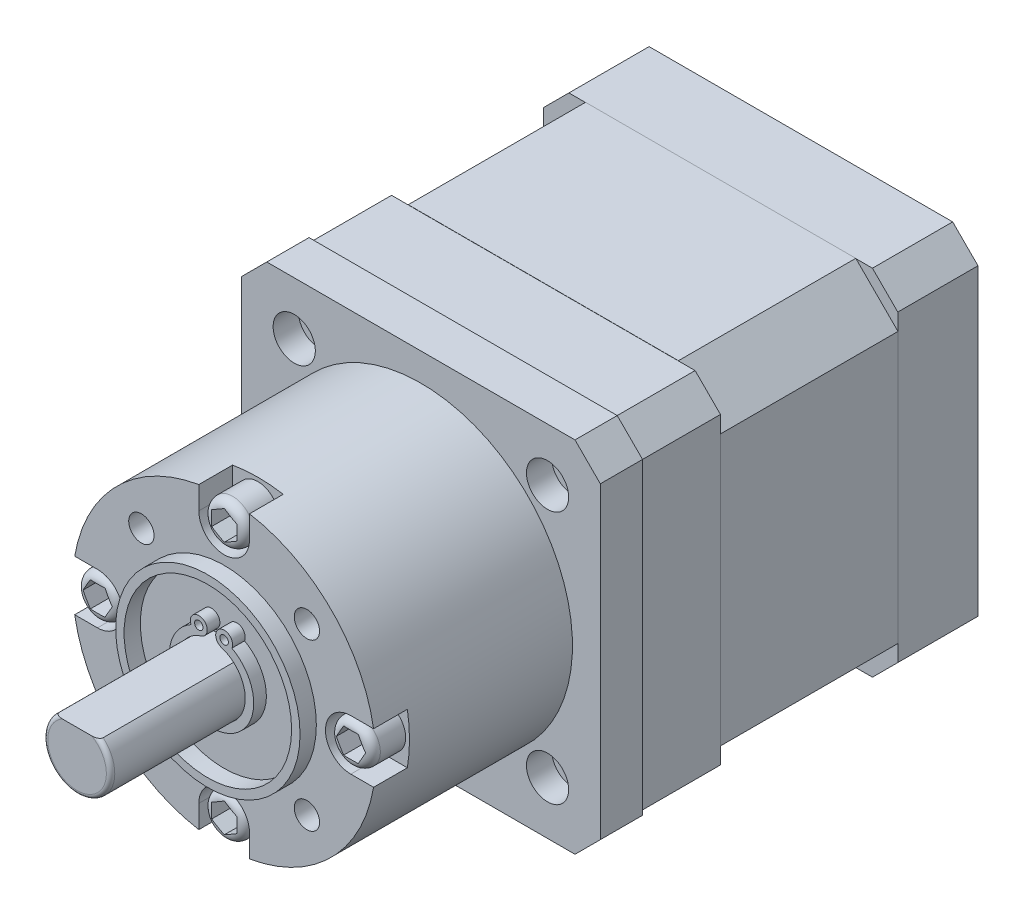
from build123d import *

# Parameters (mm, degrees)
SKETCH1_W              = 42
SKETCH1_H              = 42
BOSS_EXTRUDE1_DEPTH    = 21
CHAMFER1_SIZE          = 5
SKETCH2_W              = 41.95
SKETCH2_H              = 41.95
BOSS_EXTRUDE2_DEPTH    = 9.5
SKETCH3_R              = 17.95
BOSS_EXTRUDE3_DEPTH    = 24.3
SKETCH4_R              = 2
CUT_EXTRUDE1_DEPTH     = 1
SKETCH5_W              = 0.5
SKETCH5_H              = 1.25
SKETCH5_W_2            = 1.25
SKETCH5_H_2            = 0.5
CUT_EXTRUDE2_DEPTH     = 2
BOSS_EXTRUDE4_DEPTH    = 4
SKETCH11_R             = 3.97
BOSS_EXTRUDE5_DEPTH    = 17.42
CUT_EXTRUDE3_START     = -18
CUT_EXTRUDE3_DEPTH     = 18
SKETCH13_W             = 42.5
SKETCH13_H             = 42.5
BOSS_EXTRUDE6_DEPTH    = 5
SKETCH19_R             = 2.5
BOSS_EXTRUDE7_DEPTH    = 4
FILLET4_R              = 1
SKETCH20_R             = 0.5
BOSS_EXTRUDE8_DEPTH    = 1.5
SKETCH21_W             = 9
SKETCH21_H             = 3
SKETCH21_W_2           = 6
SKETCH21_H_2           = 2
BOSS_EXTRUDE9_DEPTH    = 1
SKETCH22_R             = 0.5
BOSS_EXTRUDE10_DEPTH   = 5
SKETCH23_R             = 0.5
BOSS_EXTRUDE11_DEPTH   = 5
BOSS_EXTRUDE11_2_DEPTH = 5
BOSS_EXTRUDE11_3_DEPTH = 5
BOSS_EXTRUDE11_4_DEPTH = 5
CHAMFER4_SIZE          = 3
SKETCH24_R             = 2.5
CUT_EXTRUDE4_DEPTH     = 3
SKETCH25_R             = 10.92
SKETCH25_R_2           = 9.92
BOSS_EXTRUDE12_DEPTH   = 1.93
SKETCH26_R             = 1.5
CUT_EXTRUDE5_DEPTH     = 7.3
FILLET5_R              = 0.5


with BuildPart() as part:
    # Sketch1 → Boss-Extrude1 (new body)
    with BuildSketch(Plane.XY):
        Rectangle(SKETCH1_W, SKETCH1_H)
    extrude(amount=BOSS_EXTRUDE1_DEPTH)

    # Chamfer1
    chamfer1_edges = [part.edges().sort_by_distance(p)[0] for p in [
        (21, -21, 10.5),
        (-21, -21, 10.5),
        (-21, 21, 10.5),
        (21, 21, 10.5),
    ]]
    chamfer(chamfer1_edges, length=CHAMFER1_SIZE)

    # Sketch2 → Boss-Extrude2 (add)
    with BuildSketch(Plane.XY.offset(21)):
        Rectangle(SKETCH2_W, SKETCH2_H)
    boss_extrude2 = extrude(amount=BOSS_EXTRUDE2_DEPTH)

    # Mirror1: Boss-Extrude2 across plane
    add(boss_extrude2.mirror(Plane.XY.offset(10.5)))

    # Sketch3 → Boss-Extrude3 (add)
    with BuildSketch(Plane.XY.offset(30.5)):
        Circle(SKETCH3_R)
    extrude(amount=BOSS_EXTRUDE3_DEPTH)

    # Sketch4 → Cut-Extrude1 (cut)
    with BuildSketch(Plane(origin=(0, 0, -9.5), x_dir=(-1, 0, 0), z_dir=(0, 0, -1))):
        with Locations((16, 16)):
            Circle(SKETCH4_R)
        with Locations((16, -16)):
            Circle(SKETCH4_R)
        with Locations((-16, -16)):
            Circle(SKETCH4_R)
        with Locations((-16, 16)):
            Circle(SKETCH4_R)
    extrude(amount=-CUT_EXTRUDE1_DEPTH, mode=Mode.SUBTRACT)

    # Sketch5 → Cut-Extrude2 (cut)
    with BuildSketch(Plane(origin=(0, 0, -8.5), x_dir=(-1, 0, 0), z_dir=(0, 0, -1))):
        with Locations((16, 16.875)):
            Rectangle(SKETCH5_W, SKETCH5_H)
        with Locations((15.125, 16)):
            Rectangle(SKETCH5_W_2, SKETCH5_H_2)
        with Locations((16, 16)):
            Rectangle(SKETCH5_W, SKETCH5_H_2)
        with Locations((16, 15.125)):
            Rectangle(SKETCH5_W, SKETCH5_H)
        with Locations((16.875, 16)):
            Rectangle(SKETCH5_W_2, SKETCH5_H_2)
        with Locations((-16, 16.875)):
            Rectangle(SKETCH5_W, SKETCH5_H)
        with Locations((-16, 16)):
            Rectangle(SKETCH5_W, SKETCH5_H_2)
        with Locations((-16.875, 16)):
            Rectangle(SKETCH5_W_2, SKETCH5_H_2)
        with Locations((-15.125, 16)):
            Rectangle(SKETCH5_W_2, SKETCH5_H_2)
        with Locations((-16, 15.125)):
            Rectangle(SKETCH5_W, SKETCH5_H)
        with Locations((-16, -15.125)):
            Rectangle(SKETCH5_W, SKETCH5_H)
        with Locations((-16, -16)):
            Rectangle(SKETCH5_W, SKETCH5_H_2)
        with Locations((-16, -16.875)):
            Rectangle(SKETCH5_W, SKETCH5_H)
        with Locations((-16.875, -16)):
            Rectangle(SKETCH5_W_2, SKETCH5_H_2)
        with Locations((-15.125, -16)):
            Rectangle(SKETCH5_W_2, SKETCH5_H_2)
        with Locations((16, -15.125)):
            Rectangle(SKETCH5_W, SKETCH5_H)
        with Locations((16, -16)):
            Rectangle(SKETCH5_W, SKETCH5_H_2)
        with Locations((16, -16.875)):
            Rectangle(SKETCH5_W, SKETCH5_H)
        with Locations((16.875, -16)):
            Rectangle(SKETCH5_W_2, SKETCH5_H_2)
        with Locations((15.125, -16)):
            Rectangle(SKETCH5_W_2, SKETCH5_H_2)
    extrude(amount=-CUT_EXTRUDE2_DEPTH, mode=Mode.SUBTRACT)

    # Sketch10 → Boss-Extrude4 (add)
    with BuildSketch(Plane.XY.offset(54.8)):
        with BuildLine():
            ThreePointArc((3, 15), (0, 12), (-3, 15))
            Line((-3, 15), (-3, 17.697528076))
            ThreePointArc((-3, 17.697528076), (-12.692566722, 12.692566722), (-17.697528076, 3))
            Line((-17.697528076, 3), (-15, 3))
            ThreePointArc((-15, 3), (-12, 0), (-15, -3))
            Line((-15, -3), (-17.697528076, -3))
            ThreePointArc((-17.697528076, -3), (-12.692566722, -12.692566722), (-3, -17.697528076))
            Line((-3, -17.697528076), (-3, -15))
            ThreePointArc((-3, -15), (0, -12), (3, -15))
            Line((3, -15), (3, -17.697528076))
            ThreePointArc((3, -17.697528076), (12.692566722, -12.692566722), (17.697528076, -3))
            Line((17.697528076, -3), (15, -3))
            ThreePointArc((15, -3), (12, 0), (15, 3))
            Line((15, 3), (17.697528076, 3))
            ThreePointArc((17.697528076, 3), (12.692566722, 12.692566722), (3, 17.697528076))
            Line((3, 17.697528076), (3, 15))
        make_face()
    extrude(amount=BOSS_EXTRUDE4_DEPTH)

    # Sketch11 → Boss-Extrude5 (add)
    with BuildSketch(Plane.XY.offset(58.8)):
        Circle(SKETCH11_R)
    extrude(amount=BOSS_EXTRUDE5_DEPTH)

    # Sketch12 → Cut-Extrude3 (cut)
    with BuildSketch(Plane.XY.offset(76.22).offset(CUT_EXTRUDE3_START)):
        with BuildLine():
            Line((-2.600173071, 3), (2.600173071, 3))
            ThreePointArc((2.600173071, 3), (0, 3.97), (-2.600173071, 3))
        make_face()
    extrude(amount=CUT_EXTRUDE3_DEPTH, mode=Mode.SUBTRACT)

    # Sketch13 → Boss-Extrude6 (add)
    with BuildSketch(Plane.XY.offset(30.5)):
        Rectangle(SKETCH13_W, SKETCH13_H)
    extrude(amount=BOSS_EXTRUDE6_DEPTH)

    # Sketch19 → Boss-Extrude7 (add)
    # profile 1 of 4: a face of its own
    with BuildSketch(Plane.XY.offset(54.8)):
        with Locations((0, 15)):
            Circle(SKETCH19_R)
        Polygon((0, 16.732050808), (-1.5, 15.866025404), (-1.5, 14.133974596), (0, 13.267949192), (1.5, 14.133974596), (1.5, 15.866025404), align=None, mode=Mode.SUBTRACT)
    # profile 2 of 4: a face of its own
    with BuildSketch(Plane.XY.offset(54.8)):
        with Locations((15, 0)):
            Circle(SKETCH19_R)
        Polygon((16.732050808, 0), (15.866025404, 1.5), (14.133974596, 1.5), (13.267949192, 0), (14.133974596, -1.5), (15.866025404, -1.5), align=None, mode=Mode.SUBTRACT)
    # profile 3 of 4: a face of its own
    with BuildSketch(Plane.XY.offset(54.8)):
        with Locations((0, -15)):
            Circle(SKETCH19_R)
        Polygon((0, -16.732050808), (1.5, -15.866025404), (1.5, -14.133974596), (0, -13.267949192), (-1.5, -14.133974596), (-1.5, -15.866025404), align=None, mode=Mode.SUBTRACT)
    # profile 4 of 4: a face of its own
    with BuildSketch(Plane.XY.offset(54.8)):
        with Locations((-15, 0)):
            Circle(SKETCH19_R)
        Polygon((-16.732050808, 0), (-15.866025404, -1.5), (-14.133974596, -1.5), (-13.267949192, 0), (-14.133974596, 1.5), (-15.866025404, 1.5), align=None, mode=Mode.SUBTRACT)
    extrude(amount=BOSS_EXTRUDE7_DEPTH)

    # Fillet4
    # the kernel refuses this fillet: 1 mm, written as the material it takes off along each edge
    with BuildSketch(Plane(origin=(0, -15, 58.8), x_dir=(1, 0, 0), z_dir=(0, -1, 0))) as fillet4_piece_1:
        with BuildLine():
            CenterArc((2.5 - FILLET4_R, -FILLET4_R), FILLET4_R, 0, 90)
            Line((2.5 - FILLET4_R, 0), (2.5, 0))
            Line((2.5, 0), (2.5, -FILLET4_R))
        make_face()
    revolve(axis=Axis((0, -15, 58.8), (0, 0, 1)), mode=Mode.SUBTRACT)
    with BuildSketch(Plane(origin=(-15, 0, 58.8), x_dir=(1, 0, 0), z_dir=(0, -1, 0))) as fillet4_piece_2:
        with BuildLine():
            CenterArc((2.5 - FILLET4_R, -FILLET4_R), FILLET4_R, 0, 90)
            Line((2.5 - FILLET4_R, 0), (2.5, 0))
            Line((2.5, 0), (2.5, -FILLET4_R))
        make_face()
    revolve(axis=Axis((-15, 0, 58.8), (0, 0, 1)), mode=Mode.SUBTRACT)
    with BuildSketch(Plane(origin=(15, 0, 58.8), x_dir=(1, 0, 0), z_dir=(0, -1, 0))) as fillet4_piece_3:
        with BuildLine():
            CenterArc((2.5 - FILLET4_R, -FILLET4_R), FILLET4_R, 0, 90)
            Line((2.5 - FILLET4_R, 0), (2.5, 0))
            Line((2.5, 0), (2.5, -FILLET4_R))
        make_face()
    revolve(axis=Axis((15, 0, 58.8), (0, 0, 1)), mode=Mode.SUBTRACT)
    with BuildSketch(Plane(origin=(0, 15, 58.8), x_dir=(1, 0, 0), z_dir=(0, -1, 0))) as fillet4_piece_4:
        with BuildLine():
            CenterArc((2.5 - FILLET4_R, -FILLET4_R), FILLET4_R, 0, 90)
            Line((2.5 - FILLET4_R, 0), (2.5, 0))
            Line((2.5, 0), (2.5, -FILLET4_R))
        make_face()
    revolve(axis=Axis((0, 15, 58.8), (0, 0, 1)), mode=Mode.SUBTRACT)

    # Sketch20 → Boss-Extrude8 (add)
    with BuildSketch(Plane.XY.offset(58.8)):
        with BuildLine():
            ThreePointArc((-1.2, 3.815756806), (0, -4), (1.2, 3.815756806))
            ThreePointArc((1.2, 3.815756806), (1.082564084, 5.678402371), (2.419157521, 4.375805856))
            ThreePointArc((2.419157521, 4.375805856), (0, -5), (-2.419157521, 4.375805856))
            ThreePointArc((-2.419157521, 4.375805856), (-1.082564084, 5.678402371), (-1.2, 3.815756806))
        make_face()
        with Locations((1.5, 4.769696007)):
            Circle(SKETCH20_R, mode=Mode.SUBTRACT)
        with Locations((-1.5, 4.769696007)):
            Circle(SKETCH20_R, mode=Mode.SUBTRACT)
    extrude(amount=BOSS_EXTRUDE8_DEPTH)

    # Chamfer4
    chamfer4_edges = [part.edges().sort_by_distance(p)[0] for p in [
        (21.25, -21.25, 33),
        (21.25, 21.25, 33),
        (-21.25, 21.25, 33),
        (-21.25, -21.25, 33),
        (20.975, -20.975, 25.75),
        (20.975, 20.975, 25.75),
        (-20.975, 20.975, 25.75),
        (-20.975, -20.975, 25.75),
        (20.975, 20.975, -4.75),
        (20.975, -20.975, -4.75),
        (-20.975, -20.975, -4.75),
        (-20.975, 20.975, -4.75),
    ]]
    chamfer(chamfer4_edges, length=CHAMFER4_SIZE)

    # Sketch24 → Cut-Extrude4 (cut)
    with BuildSketch(Plane.XY.offset(35.5)):
        with Locations((-15, 15)):
            Circle(SKETCH24_R)
        with Locations((15, 15)):
            Circle(SKETCH24_R)
        with Locations((15, -15)):
            Circle(SKETCH24_R)
        with Locations((-15, -15)):
            Circle(SKETCH24_R)
    extrude(amount=-CUT_EXTRUDE4_DEPTH, mode=Mode.SUBTRACT)

    # Sketch25 → Boss-Extrude12 (add)
    with BuildSketch(Plane.XY.offset(58.8)):
        Circle(SKETCH25_R)
        Circle(SKETCH25_R_2, mode=Mode.SUBTRACT)
    extrude(amount=BOSS_EXTRUDE12_DEPTH)

    # Sketch26 → Cut-Extrude5 (cut)
    with BuildSketch(Plane.XY.offset(58.8)):
        with Locations((-9.8, 9.8)):
            Circle(SKETCH26_R)
        with Locations((9.8, 9.8)):
            Circle(SKETCH26_R)
        with Locations((9.8, -9.8)):
            Circle(SKETCH26_R)
        with Locations((-9.8, -9.8)):
            Circle(SKETCH26_R)
    extrude(amount=-CUT_EXTRUDE5_DEPTH, mode=Mode.SUBTRACT)

    # Fillet5
    fillet5_edges = [part.edges().sort_by_distance(p)[0] for p in [
        (0, -3.97, 76.22),
    ]]
    fillet(fillet5_edges, radius=FILLET5_R)


with BuildPart() as body_2:
    # Sketch21 → Boss-Extrude9 (new body)
    with BuildSketch(Plane.XZ.offset(21)):
        with Locations((0, -5.5)):
            Rectangle(SKETCH21_W, SKETCH21_H)
        with Locations((0, -5.5)):
            Rectangle(SKETCH21_W_2, SKETCH21_H_2, mode=Mode.SUBTRACT)
    extrude(amount=BOSS_EXTRUDE9_DEPTH)


with BuildPart() as body_3:
    # Sketch22 → Boss-Extrude10 (new body)
    with BuildSketch(Plane.XZ.offset(21)):
        with Locations(Location((2.3, -5.5, 0), (0, 0, 270))):
            Circle(SKETCH22_R)
    extrude(amount=BOSS_EXTRUDE10_DEPTH)


with BuildPart() as body_4:
    # Sketch23 → Boss-Extrude11 (new body)
    with BuildSketch(Plane.XZ.offset(21)):
        with Locations(Location((0.7, -5.5, 0), (0, 0, 270))):
            Circle(SKETCH23_R)
    extrude(amount=BOSS_EXTRUDE11_DEPTH)


with BuildPart() as body_5:
    # Sketch23 → Boss-Extrude11 2 (new body)
    with BuildSketch(Plane.XZ.offset(21)):
        with Locations(Location((2.3, -5.5, 0), (0, 0, 270))):
            Circle(SKETCH23_R)
    extrude(amount=BOSS_EXTRUDE11_2_DEPTH)


with BuildPart() as body_6:
    # Sketch23 → Boss-Extrude11 3 (new body)
    with BuildSketch(Plane.XZ.offset(21)):
        with Locations(Location((-2.3, -5.5, 0), (0, 0, 90))):
            Circle(SKETCH23_R)
    extrude(amount=BOSS_EXTRUDE11_3_DEPTH)


with BuildPart() as body_7:
    # Sketch23 → Boss-Extrude11 4 (new body)
    with BuildSketch(Plane.XZ.offset(21)):
        with Locations(Location((-0.7, -5.5, 0), (0, 0, 90))):
            Circle(SKETCH23_R)
    extrude(amount=BOSS_EXTRUDE11_4_DEPTH)


solid = Compound([part.part, body_2.part, body_3.part, body_4.part, body_5.part, body_6.part, body_7.part])
